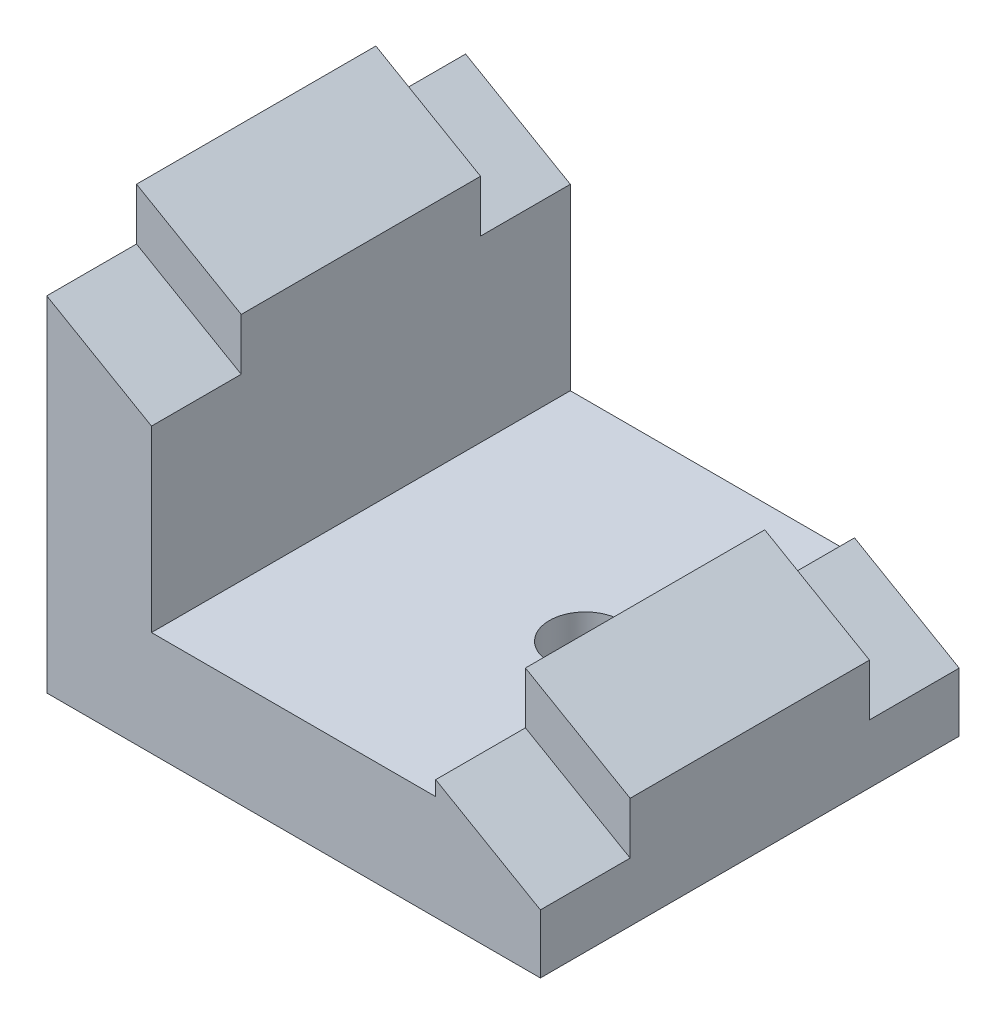
from build123d import *

# Parameters (mm, degrees)
BOSS_EXTRU_1_DEPTH      = 7
ENL_V_START             = -4
ENL_V_MAT_EXTRU_1_DEPTH = 22.382453919
D_GAGEMENT_M21_D        = 2.4
EMPREINTE1_OUTLINE_R    = 1.2
EMPREINTE1_DEPTH        = 2


# Read off the part's stored shape, not the designer's step: Empreinte1
with BuildPart() as part:
    # Esquisse1 → Boss.-Extru.1 (new, symmetric)
    with BuildSketch(Plane.XY):
        Polygon((4, 0), (4, 13.229473419), (7.5, 11.208747477), (7.5, 3.5), (17, 3.5), (17, 5.72391992), (20.5, 3.703193978), (20.5, 0), align=None)
    extrude(amount=BOSS_EXTRU_1_DEPTH, both=True)

    # Esquisse2 → Enlèv. mat.-Extru.1 (cut, through all)
    with BuildSketch(Plane.XY.offset(ENL_V_START)):
        Polygon((4, 13.229473419), (4, 11.497422612), (7.5, 9.47669667), (7.5, 11.208747477), align=None)
        Polygon((17, 5.72391992), (17, 3.991869112), (20.5, 1.97114317), (20.5, 3.703193978), align=None)
    enl_v_mat_extru_1 = extrude(amount=-ENL_V_MAT_EXTRU_1_DEPTH, mode=Mode.SUBTRACT)

    # Symétrie1: Enlèv. mat.-Extru.1 across plane
    add(enl_v_mat_extru_1.mirror(Plane.XY), mode=Mode.SUBTRACT)

    # Dégagement M21 (through all)
    with Locations(Plane(origin=(0, 0, 0), x_dir=(-1, 0, 0), z_dir=(0, -1, 0))):
        with Locations((-15, 0)):
            Hole(D_GAGEMENT_M21_D / 2)

    # Empreinte1 outline → Empreinte1 (cut)
    with BuildSketch(Plane(origin=(0, 0, 0), x_dir=(1, 0, 0), z_dir=(0, 1, 0))):
        with BuildLine():
            Line((4, -3.115617227), (15.2, -1.989974874))
            ThreePointArc((15.2, -1.989974874), (17, 0), (15.2, 1.989974874))
            Line((15.2, 1.989974874), (4, 3.115617227))
            Line((4, 3.115617227), (4, -3.115617227))
        make_face()
        with Locations((15, 0)):
            Circle(EMPREINTE1_OUTLINE_R, mode=Mode.SUBTRACT)
    extrude(amount=EMPREINTE1_DEPTH, mode=Mode.SUBTRACT)


solid = part.part
